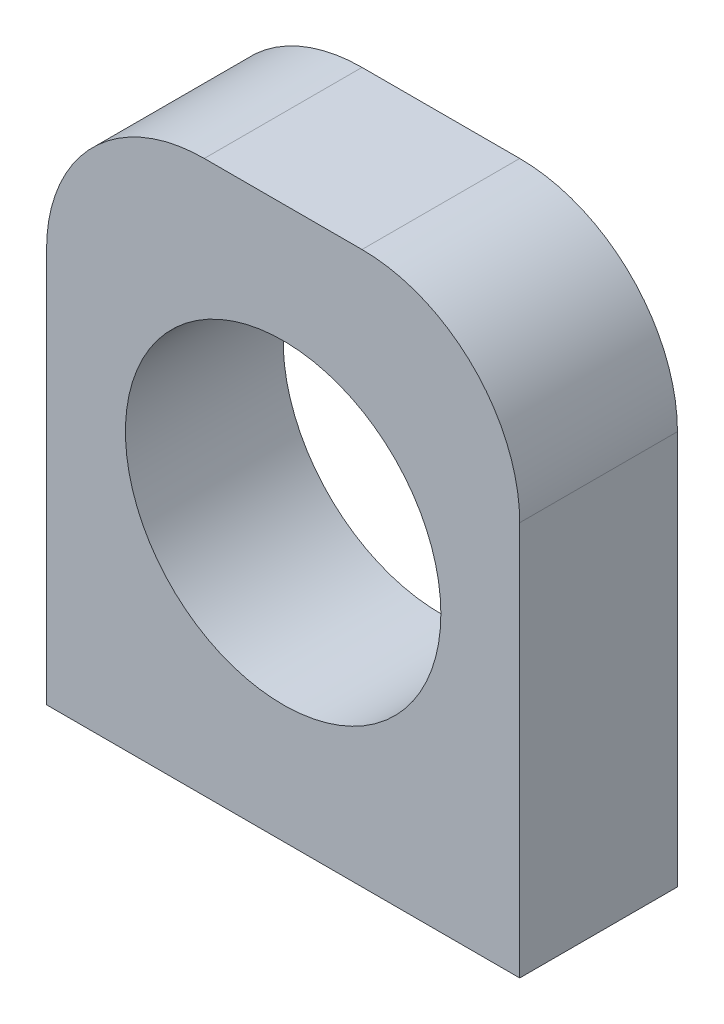
from build123d import *

# Parameters (mm, degrees)
SKETCH1_R                  = 25.4
BOSS_EXTRUDE1_DEPTH        = 12.7
F_10_32_TAPPED_HOLE1_D     = 4.0386
F_10_32_TAPPED_HOLE1_DEPTH = 12.02944
F_10_32_TAPPED_HOLE1_TIP   = 1.213317848


with BuildPart() as part:
    # Sketch1 → Boss-Extrude1 (new, symmetric)
    with BuildSketch(Plane.XY):
        with BuildLine():
            Line((38.1, -44.45), (-38.1, -44.45))
            Line((-38.1, -44.45), (-38.1, 19.05))
            ThreePointArc((-38.1, 19.05), (-30.660512242, 37.010512242), (-12.7, 44.45))
            Line((-12.7, 44.45), (12.7, 44.45))
            ThreePointArc((12.7, 44.45), (30.660512242, 37.010512242), (38.1, 19.05))
            Line((38.1, 19.05), (38.1, -44.45))
        make_face()
        Circle(SKETCH1_R, mode=Mode.SUBTRACT)
    extrude(amount=BOSS_EXTRUDE1_DEPTH, both=True)

    # #10-32 Tapped Hole1
    with Locations(Plane(origin=(0, -44.45, 0), x_dir=(-1, 0, 0), z_dir=(0, -1, 0))):
        with Locations((19.05, -7.9375), (-19.05, -7.9375), (-19.05, 7.9375), (19.05, 7.9375)):
            Hole(F_10_32_TAPPED_HOLE1_D / 2, depth=F_10_32_TAPPED_HOLE1_DEPTH)
            with Locations((0, 0, -(F_10_32_TAPPED_HOLE1_DEPTH + F_10_32_TAPPED_HOLE1_TIP / 2))):  # 118° drill point
                Cone(0, F_10_32_TAPPED_HOLE1_D / 2, F_10_32_TAPPED_HOLE1_TIP, mode=Mode.SUBTRACT)


solid = part.part
